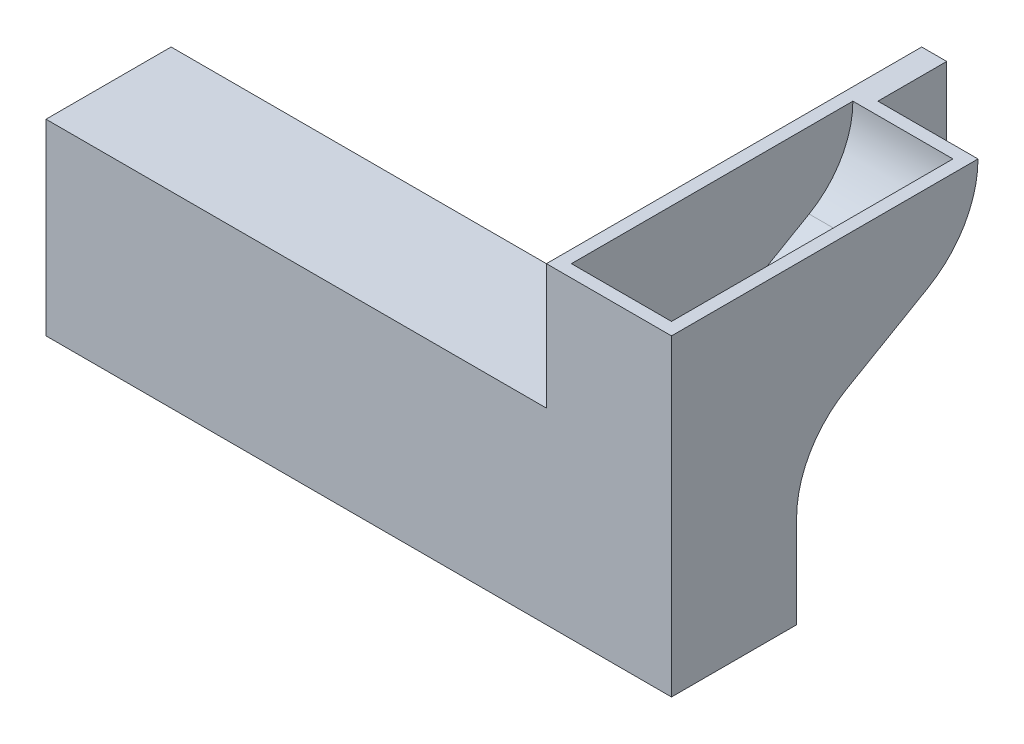
from build123d import *

# Parameters (mm, degrees)
SKETCH1_W           = 40
SKETCH1_H           = 10
BOSS_EXTRUDE1_DEPTH = 15
BOSS_EXTRUDE2_DEPTH = 10
BOSS_EXTRUDE3_DEPTH = 2
SHELL1_START        = -19
SHELL1_OUTLINE_W    = 13
SHELL1_OUTLINE_H    = 8
SHELL1_DEPTH        = 48
SHELL1_START_2      = 21
SHELL1_2_DEPTH      = 8
FILLET1_R           = 4


# Read off the part's stored shape, not the designer's step: Shell1
with BuildPart() as part:
    # Sketch1 → Boss-Extrude1 (new body)
    with BuildSketch(Plane(origin=(0, 0, 0), x_dir=(1, 0, 0), z_dir=(0, 1, 0))):
        with Locations((0, -5)):
            Rectangle(SKETCH1_W, SKETCH1_H)
    extrude(amount=BOSS_EXTRUDE1_DEPTH)

    # Sketch2 → Boss-Extrude2 (add)
    with BuildSketch(Plane(origin=(20, 0, 0), x_dir=(0, 0, -1), z_dir=(1, 0, 0))):
        with BuildLine():
            Line((-10, 0), (-10, 25))
            Line((-10, 25), (14.5, 25))
            ThreePointArc((14.5, 25), (13.42820323, 21), (10.5, 18.07179677))
            Line((10.5, 18.07179677), (4, 14.31902002))
            ThreePointArc((4, 14.31902002), (1.07179677, 11.39081679), (0, 7.39081679))
            Line((0, 7.39081679), (0, 0))
            Line((0, 0), (-10, 0))
        make_face()
    extrude(amount=BOSS_EXTRUDE2_DEPTH)

    # Sketch3 → Boss-Extrude3 (add)
    with BuildSketch(Plane.ZY.offset(-20)):
        with BuildLine():
            Line((-5.179491924, 15), (-20, 15))
            Line((-20, 15), (-20, 25))
            Line((-20, 25), (-14.5, 25))
            ThreePointArc((-14.5, 25), (-13.42820323, 21), (-10.5, 18.07179677))
            Line((-10.5, 18.07179677), (-5.179491924, 15))
        make_face()
    extrude(amount=-BOSS_EXTRUDE3_DEPTH)

    # Shell1 outline → Shell1 (cut)
    with BuildSketch(Plane.YZ.offset(SHELL1_START)):
        with Locations((7.5, 5)):
            Rectangle(SHELL1_OUTLINE_W, SHELL1_OUTLINE_H)
    extrude(amount=SHELL1_DEPTH, mode=Mode.SUBTRACT)

    # Shell1 2 outline → Shell1 2 (cut)
    with BuildSketch(Plane.YZ.offset(SHELL1_START_2)):
        with BuildLine():
            ThreePointArc((18.937822174, -10), (21.5, -12.562177826), (25, -13.5))
            Line((25, -13.5), (25, 9))
            Line((25, 9), (14, 9))
            Line((14, 9), (14, 1))
            Line((14, 1), (7.39081679, 1))
            ThreePointArc((7.39081679, 1), (11.89081679, -0.205771366), (15.185045424, -3.5))
            Line((15.185045424, -3.5), (18.937822174, -10))
        make_face()
    extrude(amount=SHELL1_2_DEPTH, mode=Mode.SUBTRACT)

    # Fillet1
    fillet1_edges = [part.edges().sort_by_distance(p)[0] for p in [
        (-19, 7.5, 1),
        (-19, 7.5, 9),
    ]]
    fillet(fillet1_edges, radius=FILLET1_R - 0.0001)  # a hair under: the kernel refuses the full size


solid = part.part
